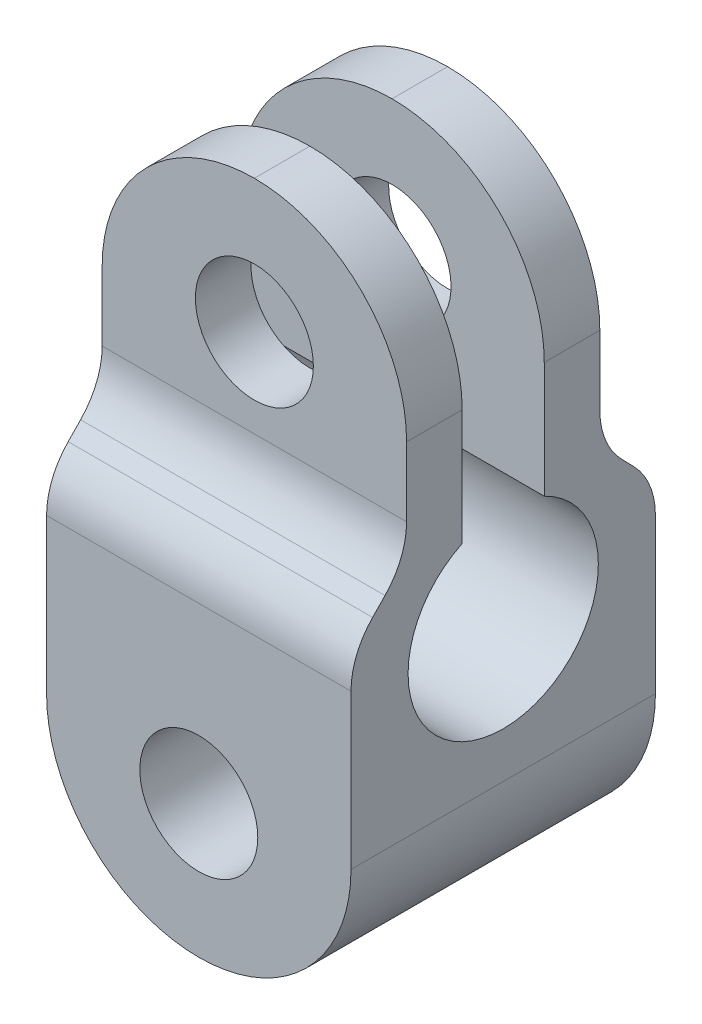
from build123d import *

# Parameters (mm, degrees)
SKETCH_1_W          = 8
SKETCH_1_H          = 17
EXTRUDE_2_DEPTH     = 8
FILLET_2_R          = 4
SKETCH_2_R          = 1.55
CUT_EXTRUDE_1_DEPTH = 8
SKETCH_3_R          = 2.5
CUT_EXTRUDE_2_DEPTH = 8
CUT_EXTRUDE_4_DEPTH = 8
CUT_EXTRUDE_5_DEPTH = 8
FILLET_3_R          = 2


with BuildPart() as part:
    # 草图1 → 凸台-拉伸2 (new body)
    with BuildSketch(Plane.XY):
        with Locations((-4, 8.5)):
            Rectangle(SKETCH_1_W, SKETCH_1_H)
    extrude(amount=EXTRUDE_2_DEPTH)

    # 圆角2
    fillet_2_edges = [part.edges().sort_by_distance(p)[0] for p in [
        (0, 0, 4),
        (-8, 0, 4),
        (0, 17, 4),
        (-8, 17, 4),
    ]]
    fillet(fillet_2_edges, radius=FILLET_2_R - 0.0001)  # a hair under: the kernel refuses the full size

    # 草图2 → 切除-拉伸1 (cut)
    with BuildSketch(Plane.XY.offset(8)):
        with Locations((-4, 13.5)):
            Circle(SKETCH_2_R)
        with Locations((-4, 3.5)):
            Circle(SKETCH_2_R)
    extrude(amount=-CUT_EXTRUDE_1_DEPTH, mode=Mode.SUBTRACT)

    # 草图3 → 切除-拉伸2 (cut)
    with BuildSketch(Plane.ZY.offset(8)):
        with Locations((4, 7.7)):
            Circle(SKETCH_3_R)
    extrude(amount=-CUT_EXTRUDE_2_DEPTH, mode=Mode.SUBTRACT)

    # 草图4 → 切除-拉伸4 (cut)
    with BuildSketch(Plane.ZY.offset(8)):
        with BuildLine():
            Line((2.921520253, 9.955411589), (2.921520253, 17))
            Line((2.921520253, 17), (5.078479747, 17))
            Line((5.078479747, 17), (5.078479747, 9.955411589))
            Line((5.078479747, 9.955411589), (5.078479747, 9.786617836))
            ThreePointArc((5.078479747, 9.786617836), (4, 10.033067636), (2.921520253, 9.786617836))
            Line((2.921520253, 9.786617836), (2.921520253, 9.955411589))
        make_face()
    extrude(amount=-CUT_EXTRUDE_4_DEPTH, mode=Mode.SUBTRACT)

    # 草图5 → 切除-拉伸5 (cut)
    with BuildSketch(Plane.ZY.offset(8)):
        Polygon((0, 8.869306394), (1.460760126, 10.369306394), (1.460760126, 17), (0, 17), align=None)
        Polygon((8, 17), (8, 8.869306394), (6.539239874, 10.369306394), (6.539239874, 17), align=None)
    extrude(amount=-CUT_EXTRUDE_5_DEPTH, mode=Mode.SUBTRACT)

    # 圆角3
    fillet_3_edges = [part.edges().sort_by_distance(p)[0] for p in [
        (-4, 10.369306394, 6.539239874),
        (-4, 8.869306394, 8),
        (-4, 8.869306394, 0),
        (-4, 10.369306394, 1.460760126),
    ]]
    fillet(fillet_3_edges, radius=FILLET_3_R)


solid = part.part
